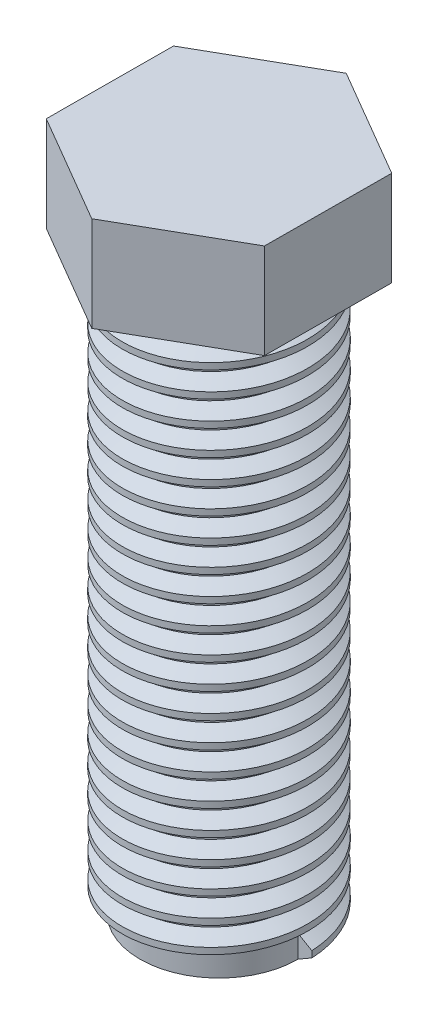
from build123d import *
from build123d.topology import SkipClean

# Parameters (mm, degrees)
SKETCH1_R           = 12.5
BOSS_EXTRUDE1_DEPTH = 90
BOSS_EXTRUDE2_DEPTH = 15
THREAD1_PITCH       = 4


with BuildPart() as part:
    # Sketch1 → Boss-Extrude1 (new body)
    with BuildSketch(Plane(origin=(0, 0, 0), x_dir=(1, 0, 0), z_dir=(0, 1, 0))):
        with Locations(Location((0, 0, 0), (0, 0, 90))):
            Circle(SKETCH1_R)
    extrude(amount=BOSS_EXTRUDE1_DEPTH)

    # Sketch2 → Boss-Extrude2 (add)
    with BuildSketch(Plane(origin=(0, 90, 0), x_dir=(1, 0, 0), z_dir=(0, 1, 0))):
        Polygon((17.270921997, -10.085398028), (17.369671898, 9.914358182), (0.098749901, 19.99975621), (-17.270921997, 10.085398028), (-17.369671898, -9.914358182), (-0.098749901, -19.99975621), align=None)
    extrude(amount=BOSS_EXTRUDE2_DEPTH)

    # Thread1: the profile of Thread Profile1 profile screwed along a right-hand helix of 22.5 turns, 12 arcs to a turn; built about Z, then put on its axis
    with SkipClean():  # the faces are left unmerged after this step: merging them gives an invalid solid
        thread1_z = Axis((0, 0, 0), (0, 0, 1))
        thread1_corners = [(12.4997, 0, -0.000173205), (12.4997, 0, 3.500173194), (14.6650635, 0, 2.249999995), (14.6650635, 0, 1.249999995)]
        with BuildLine(mode=Mode.PRIVATE) as thread1_profile:
            Line(thread1_corners[0], thread1_corners[1])
            Line(thread1_corners[1], thread1_corners[2])
            Line(thread1_corners[2], thread1_corners[3])
            Line(thread1_corners[3], thread1_corners[0])
        thread1_cap = Face(thread1_profile.wire())
        thread1_turn_angles = [0, 15, 30, 45, 60, 75, 90, 105, 120, 135, 150, 165, 180, 195, 210, 225, 240, 255, 270, 285, 300, 315, 330, 345, 360]
        thread1_turn_weights = [1, 0.9659258262890683, 1, 0.9659258262890683, 1, 0.9659258262890683, 1, 0.9659258262890683, 1, 0.9659258262890683, 1, 0.9659258262890683, 1, 0.9659258262890683, 1, 0.9659258262890683, 1, 0.9659258262890683, 1, 0.9659258262890683, 1, 0.9659258262890683, 1, 0.9659258262890683, 1]
        thread1_turn_rails = [Edge.make_bspline([Vector(p[0], p[1], 0).rotate(thread1_z, thread1_turn_angles[k]) / thread1_turn_weights[k] + Vector(0, 0, p[2] + THREAD1_PITCH * thread1_turn_angles[k] / 360) for k in range(25)], [0, 0, 0, 1, 1, 2, 2, 3, 3, 4, 4, 5, 5, 6, 6, 7, 7, 8, 8, 9, 9, 10, 10, 11, 11, 12, 12, 12], 2, thread1_turn_weights) for p in thread1_corners]
        thread1_turn_sides = [Face.make_surface_from_curves(thread1_turn_rails[p[0]], thread1_turn_rails[p[1]]) for p in [(0, 1), (1, 2), (2, 3), (3, 0)]]
        thread1_last_angles = [7920, 7935, 7950, 7965, 7980, 7995, 8010, 8025, 8040, 8055, 8070, 8085, 8100]
        thread1_last_weights = [1, 0.9659258262890683, 1, 0.9659258262890683, 1, 0.9659258262890683, 1, 0.9659258262890683, 1, 0.9659258262890683, 1, 0.9659258262890683, 1]
        thread1_last_rails = [Edge.make_bspline([Vector(p[0], p[1], 0).rotate(thread1_z, thread1_last_angles[k]) / thread1_last_weights[k] + Vector(0, 0, p[2] + THREAD1_PITCH * thread1_last_angles[k] / 360) for k in range(13)], [0, 0, 0, 1, 1, 2, 2, 3, 3, 4, 4, 5, 5, 6, 6, 6], 2, thread1_last_weights) for p in thread1_corners]
        thread1_last_sides = [Face.make_surface_from_curves(thread1_last_rails[p[0]], thread1_last_rails[p[1]]) for p in [(0, 1), (1, 2), (2, 3), (3, 0)]]
        thread1 = Plane(origin=(0, 0, 0), x_dir=(1, 0, 0), z_dir=(0, 1, 0)) * Solid(Shell([*[p.moved(Location((0, 0, THREAD1_PITCH * i))) for i in range(22) for p in thread1_turn_sides], *thread1_last_sides, thread1_cap, thread1_cap.rotate(thread1_z, 8100).moved(Location((0, 0, THREAD1_PITCH * 8100 / 360)))]))
        add(thread1)


solid = part.part
